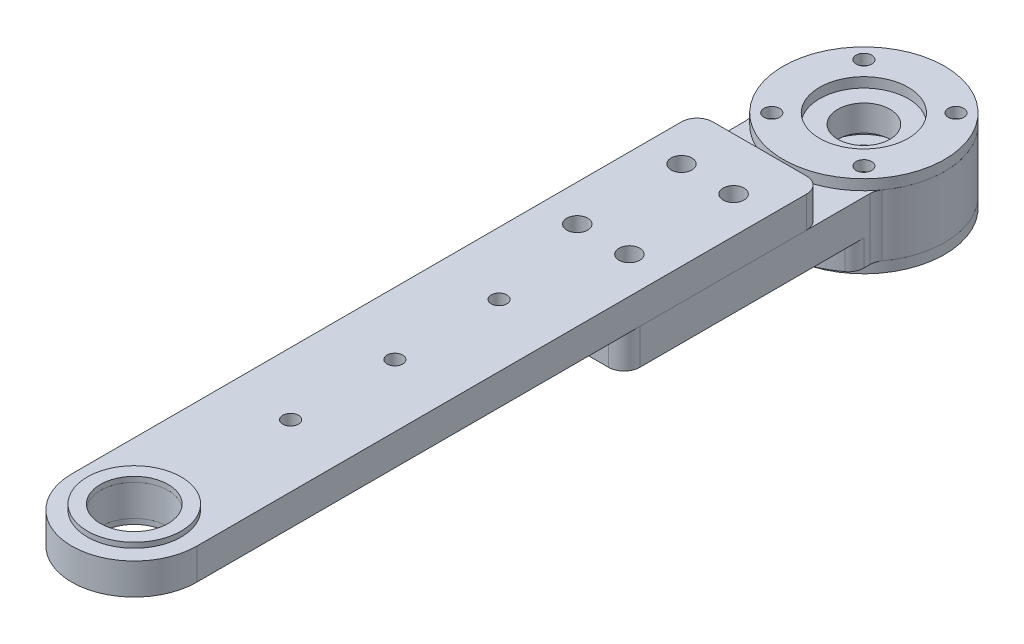
from build123d import *

# Parameters (mm, degrees)
SKETCH_1_R             = 8
EXTRUDE_1_DEPTH        = 6
SKETCH_2_R             = 8
SKETCH_2_R_2           = 5
EXTRUDE_2_DEPTH        = 6
EXTRUDE_2_2_DEPTH      = 6
SKETCH_3_R             = 8
SKETCH_3_R_2           = 5
EXTRUDE_3_DEPTH        = 0.5
EXTRUDE_3_2_DEPTH      = 0.5
PATTERN_LINEAR_1_COUNT = 2
PATTERN_LINEAR_1_PITCH = 6.5
SKETCH_4_R             = 2
SKETCH_4_R_2           = 1.5
CUT_EXTRUDE_1_DEPTH    = 10
SKETCH_5_R             = 9.475
SKETCH_5_R_2           = 1.65
EXTRUDE_4_DEPTH        = 11.8
CUT_EXTRUDE_4_DEPTH    = 158.281085958
CUT_EXTRUDE_2_DEPTH    = 5
SKETCH_8_W             = 6
SKETCH_8_H             = 14
CUT_EXTRUDE_3_DEPTH    = 158.338456837
FILLET_2_R             = 3
SKETCH_11_R            = 8
SKETCH_11_R_2          = 6.5
EXTRUDE_5_DEPTH        = 6
SKETCH_14_R            = 9
SKETCH_14_R_2          = 6.5
EXTRUDE_7_DEPTH        = 1
PATTERN_LINEAR_2_COUNT = 2
PATTERN_LINEAR_2_PITCH = 7
FILLET_1_R             = 3
EXTRUDE_START          = -4.9
SKETCH_16_R            = 9.475
SKETCH_16_R_2          = 7.5
EXTRUDE_8_DEPTH        = 2
SKETCH_17_R            = 9.5
SKETCH_17_R_2          = 5
EXTRUDE_9_DEPTH        = 5
SKETCH_18_R            = 15.5
SKETCH_18_R_2          = 1.5
SKETCH_18_R_3          = 8.5
EXTRUDE_10_DEPTH       = 2
SKETCH_20_R            = 1.25
CUT_EXTRUDE_5_DEPTH    = 158.39739515


with BuildPart() as part:
    # 草图1 → 凸台-拉伸1 (new body)
    with BuildSketch(Plane(origin=(0, 0, 0), x_dir=(1, 0, 0), z_dir=(0, 1, 0))):
        with BuildLine():
            Line((-12, 140), (-12, 0))
            ThreePointArc((-12, 0), (0, -12), (12, 0))
            Line((12, 0), (12, 140))
            ThreePointArc((12, 140), (0, 152), (-12, 140))
        make_face()
        with Locations(Location((0, 0, 0), (0, 0, 270))):
            Circle(SKETCH_1_R, mode=Mode.SUBTRACT)
        with Locations(Location((0, 140, 0), (0, 0, 270))):
            Circle(SKETCH_1_R, mode=Mode.SUBTRACT)
    extrude(amount=EXTRUDE_1_DEPTH)

    # 草图4 → 切除-拉伸1 (cut)
    with BuildSketch(Plane.XZ):
        with Locations(Location((5, -90, 0), (0, 0, 270))):
            Circle(SKETCH_4_R)
        with Locations(Location((-5, -90, 0), (0, 0, 270))):
            Circle(SKETCH_4_R)
        with Locations(Location((-5, -110, 0), (0, 0, 270))):
            Circle(SKETCH_4_R)
        with Locations(Location((5, -110, 0), (0, 0, 270))):
            Circle(SKETCH_4_R)
        with Locations(Location((0, -70, 0), (0, 0, 270))):
            Circle(SKETCH_4_R_2)
        with Locations(Location((0, -50, 0), (0, 0, 270))):
            Circle(SKETCH_4_R_2)
        with Locations(Location((0, -30, 0), (0, 0, 270))):
            Circle(SKETCH_4_R_2)
    extrude(amount=-CUT_EXTRUDE_1_DEPTH, mode=Mode.SUBTRACT)

    # 草图9 → 切除-拉伸4 (cut, through all)
    with BuildSketch(Plane(origin=(0, 6, 0), x_dir=(1, 0, 0), z_dir=(0, 1, 0))):
        with BuildLine():
            Line((-12, 120), (12, 120))
            Line((12, 120), (12, 140))
            ThreePointArc((12, 140), (0, 152), (-12, 140))
            Line((-12, 140), (-12, 120))
        make_face()
    extrude(amount=-CUT_EXTRUDE_4_DEPTH, mode=Mode.SUBTRACT)

    # 圆角2
    fillet_2_edges = [part.edges().sort_by_distance(p)[0] for p in [
        (-12, 3, -120),
        (12, 3, -120),
    ]]
    fillet(fillet_2_edges, radius=FILLET_2_R)


with BuildPart() as body_2:
    # 草图2 → 凸台-拉伸2 (new body)
    with BuildSketch(Plane(origin=(0, 6, 0), x_dir=(1, 0, 0), z_dir=(0, 1, 0))):
        with Locations(Location((0, 0, 0), (0, 0, 270))):
            Circle(SKETCH_2_R)
        with Locations(Location((0, 0, 0), (0, 0, 270))):
            Circle(SKETCH_2_R_2, mode=Mode.SUBTRACT)
    extrude(amount=-EXTRUDE_2_DEPTH)


with BuildPart() as body_3:
    # 草图2 → Extrude 2 2 (new body)
    with BuildSketch(Plane(origin=(0, 6, 0), x_dir=(1, 0, 0), z_dir=(0, 1, 0))):
        with Locations(Location((0, 140, 0), (0, 0, 270))):
            Circle(SKETCH_2_R)
        with Locations(Location((0, 140, 0), (0, 0, 270))):
            Circle(SKETCH_2_R_2, mode=Mode.SUBTRACT)
    extrude(amount=-EXTRUDE_2_2_DEPTH)


with BuildPart() as body_4:
    # 草图3 → 凸台-拉伸3 (new body)
    with BuildSketch(Plane.XZ):
        with Locations(Location((0, 0, 0), (0, 0, 90))):
            Circle(SKETCH_3_R)
        with Locations(Location((0, 0, 0), (0, 0, 270))):
            Circle(SKETCH_3_R_2, mode=Mode.SUBTRACT)
    extrude(amount=EXTRUDE_3_DEPTH)


with BuildPart() as body_5:
    # 草图3 → Extrude 3 2 (new body)
    with BuildSketch(Plane.XZ):
        with Locations(Location((0, -140, 0), (0, 0, 90))):
            Circle(SKETCH_3_R)
        with Locations(Location((0, -140, 0), (0, 0, 90))):
            Circle(SKETCH_3_R_2, mode=Mode.SUBTRACT)
    extrude(amount=EXTRUDE_3_2_DEPTH)


with BuildPart() as pattern_linear_1_1:
    # 阵列(线性)1: pattern copy
    add(body_4.part.moved(Location(Vector(0, 1, 0) * (1 * PATTERN_LINEAR_1_PITCH))))


with BuildPart() as pattern_linear_1_2:
    # 阵列(线性)1: pattern copy
    add(body_5.part.moved(Location(Vector(0, 1, 0) * (1 * PATTERN_LINEAR_1_PITCH))))


with BuildPart() as body_8:
    # 草图5 → 凸台-拉伸4 (new body)
    with BuildSketch(Plane(origin=(0, 0, 0), x_dir=(1, 0, 0), z_dir=(0, 1, 0))):
        with BuildLine():
            Line((-12, 82), (12, 82))
            Line((12, 82), (12, 130.189291565))
            ThreePointArc((12, 130.189291565), (0, 155.5), (-12, 130.189291565))
            Line((-12, 130.189291565), (-12, 82))
        make_face()
        with Locations(Location((0, 140, 0), (0, 0, 270))):
            Circle(SKETCH_5_R, mode=Mode.SUBTRACT)
        with Locations(Location((-5, 110, 0), (0, 0, 270))):
            Circle(SKETCH_5_R_2, mode=Mode.SUBTRACT)
        with Locations(Location((-5, 90, 0), (0, 0, 270))):
            Circle(SKETCH_5_R_2, mode=Mode.SUBTRACT)
        with Locations(Location((5, 90, 0), (0, 0, 270))):
            Circle(SKETCH_5_R_2, mode=Mode.SUBTRACT)
        with Locations(Location((5, 110, 0), (0, 0, 270))):
            Circle(SKETCH_5_R_2, mode=Mode.SUBTRACT)
    extrude(amount=-EXTRUDE_4_DEPTH)

    # 草图6 → 切除-拉伸2 (cut)
    with BuildSketch(Plane.XZ.offset(11.8)):
        with BuildLine():
            Line((-12, -82), (-12, -126.583592135))
            ThreePointArc((-12, -126.583592135), (0, -122), (12, -126.583592135))
            Line((12, -126.583592135), (12, -82))
            Line((12, -82), (-12, -82))
        make_face()
    extrude(amount=-CUT_EXTRUDE_2_DEPTH, mode=Mode.SUBTRACT)

    # 草图8 → 切除-拉伸3 (cut, through all)
    with BuildSketch(Plane.XZ.offset(11.8)):
        with Locations((0, -100)):
            Rectangle(SKETCH_8_W, SKETCH_8_H)
    extrude(amount=-CUT_EXTRUDE_3_DEPTH, mode=Mode.SUBTRACT)

    # 圆角1
    fillet_1_edges = [body_8.edges().sort_by_distance(p)[0] for p in [
        (12, -9.3, -126.583592135),
        (-12, -9.3, -126.583592135),
        (-12, -3.4, -82),
        (12, -3.4, -82),
        (3, -3.4, -93),
        (3, -3.4, -107),
        (-3, -3.4, -107),
        (-3, -3.4, -93),
        (12, -5.9, -130.189291565),
        (-12, -5.9, -130.189291565),
    ]]
    fillet(fillet_1_edges, radius=FILLET_1_R - 0.0001)  # a hair under: the kernel refuses the full size

    # 草图16 → 凸台-拉伸8 (add)
    with BuildSketch(Plane(origin=(0, 0, 0), x_dir=(1, 0, 0), z_dir=(0, 1, 0)).offset(EXTRUDE_START)):
        with Locations(Location((0, 140, 0), (0, 0, 270))):
            Circle(SKETCH_16_R)
        with Locations(Location((0, 140, 0), (0, 0, 270))):
            Circle(SKETCH_16_R_2, mode=Mode.SUBTRACT)
    extrude(amount=-EXTRUDE_8_DEPTH)

    # 草图20 → 切除-拉伸5 (cut, through all)
    with BuildSketch(Plane.XZ.offset(11.8)):
        with Locations(Location((-8.838834765, -131.161165235, 0), (0, 0, 270))):
            Circle(SKETCH_20_R)
        with Locations(Location((8.838834765, -131.161165235, 0), (0, 0, 270))):
            Circle(SKETCH_20_R)
        with Locations(Location((-8.838834765, -148.838834765, 0), (0, 0, 270))):
            Circle(SKETCH_20_R)
        with Locations(Location((8.838834765, -148.838834765, 0), (0, 0, 270))):
            Circle(SKETCH_20_R)
    extrude(amount=-CUT_EXTRUDE_5_DEPTH, mode=Mode.SUBTRACT)


with BuildPart() as body_5_1:
    # Move Body 2: read off the stored shape, not the designer's step
    # Move Body 2: moved
    add(body_5.part.moved(Location((0, -11.8, 0))))


with BuildPart() as pattern_linear_1_2_1:
    # Move Body 3: read off the stored shape, not the designer's step
    # Move Body 3: moved
    add(pattern_linear_1_2.part.moved(Location((0, -6, 0))))


with BuildPart() as body_3_2:
    # 草图11 → 凸台-拉伸5 (new body)
    with BuildSketch(Plane.XZ):
        with Locations(Location((0, 0, 0), (0, 0, 270))):
            Circle(SKETCH_11_R)
        with Locations(Location((0, 0, 0), (0, 0, 270))):
            Circle(SKETCH_11_R_2, mode=Mode.SUBTRACT)
    extrude(amount=-EXTRUDE_5_DEPTH)


with BuildPart() as body_4_2:
    # 草图14 → 凸台-拉伸7 (new body)
    with BuildSketch(Plane(origin=(0, 6, 0), x_dir=(1, 0, 0), z_dir=(0, 1, 0))):
        with Locations(Location((0, 0, 0), (0, 0, 270))):
            Circle(SKETCH_14_R)
        with Locations(Location((0, 0, 0), (0, 0, 270))):
            Circle(SKETCH_14_R_2, mode=Mode.SUBTRACT)
    extrude(amount=EXTRUDE_7_DEPTH)


with BuildPart() as pattern_linear_2_1:
    # 阵列(线性)2: pattern copy
    add(body_4_2.part.moved(Location(Vector(0, -1, 0) * (1 * PATTERN_LINEAR_2_PITCH))))


with BuildPart() as body_6:
    # 草图17 → 凸台-拉伸9 (new body)
    with BuildSketch(Plane.XZ.offset(6.9)):
        with Locations(Location((0, -140, 0), (0, 0, 270))):
            Circle(SKETCH_17_R)
        with Locations(Location((0, -140, 0), (0, 0, 270))):
            Circle(SKETCH_17_R_2, mode=Mode.SUBTRACT)
    extrude(amount=EXTRUDE_9_DEPTH)


with BuildPart() as body_7:
    # 草图18 → 凸台-拉伸10 (new body)
    with BuildSketch(Plane.XZ.offset(11.8)):
        with Locations(Location((0, -140, 0), (0, 0, 270))):
            Circle(SKETCH_18_R)
        with Locations(Location((-8.838834765, -131.161165235, 0), (0, 0, 270))):
            Circle(SKETCH_18_R_2, mode=Mode.SUBTRACT)
        with Locations(Location((8.838834765, -131.161165235, 0), (0, 0, 270))):
            Circle(SKETCH_18_R_2, mode=Mode.SUBTRACT)
        with Locations(Location((8.838834765, -148.838834765, 0), (0, 0, 270))):
            Circle(SKETCH_18_R_2, mode=Mode.SUBTRACT)
        with Locations(Location((-8.838834765, -148.838834765, 0), (0, 0, 270))):
            Circle(SKETCH_18_R_2, mode=Mode.SUBTRACT)
        with Locations(Location((0, -140, 0), (0, 0, 270))):
            Circle(SKETCH_18_R_3, mode=Mode.SUBTRACT)
    extrude(amount=EXTRUDE_10_DEPTH)


with BuildPart() as body_8_2:
    # 镜向1: mirrored copy
    add(body_7.part.mirror(Plane.ZX.offset(-5.9)))


with BuildPart() as body_9:
    # Mirror 1 2: mirrored copy
    add(body_6.part.mirror(Plane.ZX.offset(-5.9)))


solid = Compound([part.part, body_8.part, body_3_2.part, body_4_2.part, pattern_linear_2_1.part, body_6.part, body_7.part, body_8_2.part, body_9.part])
